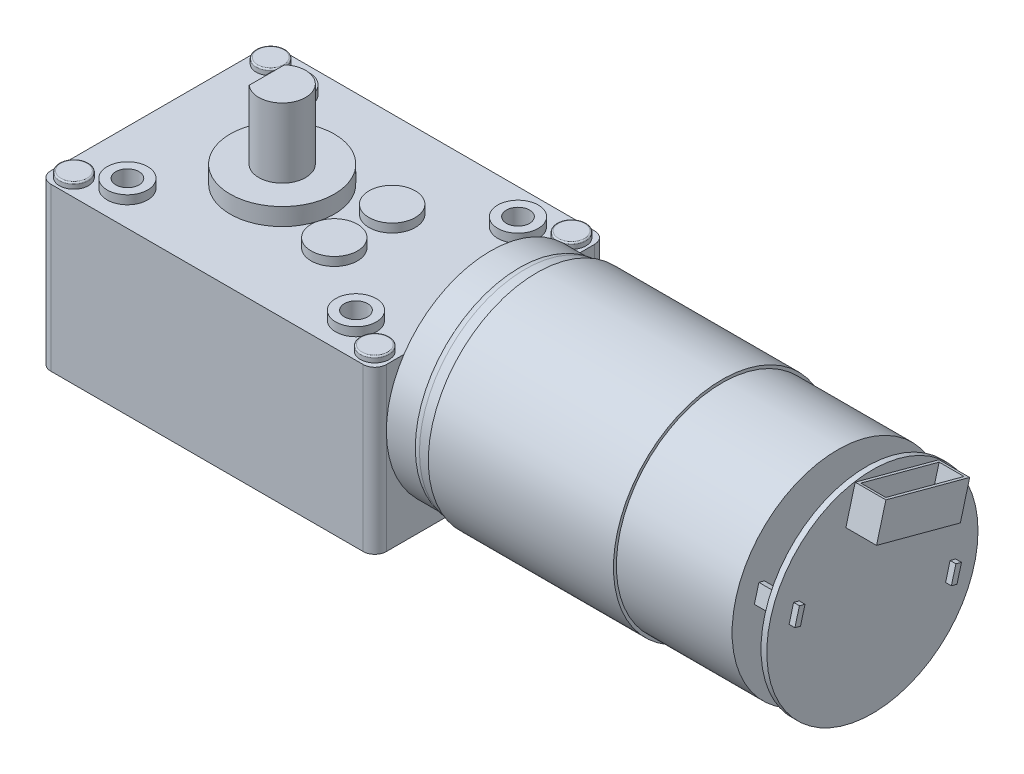
from build123d import *

# Parameters (mm, degrees)
CROQUIS1_W               = 58
CROQUIS1_H               = 40
SALIENTE_EXTRUIR1_DEPTH  = 28
CROQUIS2_R               = 2.5
SALIENTE_EXTRUIR2_DEPTH  = 1
SALIENTE_EXTRUIR3_DEPTH  = 1.5
CROQUIS4_R               = 9
CROQUIS4_R_2             = 4.05
SALIENTE_EXTRUIR4_DEPTH  = 3
CROQUIS5_R               = 4
SALIENTE_EXTRUIR5_DEPTH  = 1.5
REDONDEO1_R              = 0.25
REDONDEO2_R              = 0.1
REDONDEO3_R              = 2
SALIENTE_EXTRUIR6_START  = -31
CROQUIS7_R               = 3.5
CROQUIS7_R_2             = 2
SALIENTE_EXTRUIR6_DEPTH  = 31
SALIENTE_EXTRUIR7_START  = -33.5
CROQUIS8_R               = 9
CROQUIS8_R_2             = 4.05
SALIENTE_EXTRUIR7_DEPTH  = 33.5
SALIENTE_EXTRUIR8_START  = -30.5
CROQUIS9_R               = 4
SALIENTE_EXTRUIR8_DEPTH  = 30.5
CORTAR_EXTRUIR1_START    = -30.5
CROQUIS10_R              = 2
CORTAR_EXTRUIR1_DEPTH    = 30.5
SALIENTE_EXTRUIR9_DEPTH  = 15
CROQUIS12_R              = 18
SALIENTE_EXTRUIR10_DEPTH = 5
CROQUIS13_R              = 18.25
SALIENTE_EXTRUIR11_DEPTH = 3
REDONDEO4_R              = 2
CROQUIS14_R              = 18.75
SALIENTE_EXTRUIR12_DEPTH = 32
CROQUIS15_R              = 18.25
SALIENTE_EXTRUIR13_DEPTH = 20
SALIENTE_EXTRUIR14_DEPTH = 5
CROQUIS18_R              = 18.25
SALIENTE_EXTRUIR15_DEPTH = 1
SALIENTE_EXTRUIR16_DEPTH = 1
SALIENTE_EXTRUIR17_DEPTH = 5.3
CROQUIS21_W              = 4.3
CROQUIS21_H              = 14
CORTAR_EXTRUIR2_DEPTH    = 6


with BuildPart() as part:
    # Croquis1 → Saliente-Extruir1 (new body)
    with BuildSketch(Plane(origin=(0, 0, 0), x_dir=(1, 0, 0), z_dir=(0, 1, 0))):
        Rectangle(CROQUIS1_W, CROQUIS1_H)
    extrude(amount=SALIENTE_EXTRUIR1_DEPTH)

    # Croquis2 → Saliente-Extruir2 (add)
    with BuildSketch(Plane(origin=(0, 28, 0), x_dir=(1, 0, 0), z_dir=(0, 1, 0))):
        with Locations(Location((-26, 17, 0), (0, 0, 90))):
            Circle(CROQUIS2_R)
        with Locations(Location((26, 17, 0), (0, 0, 90))):
            Circle(CROQUIS2_R)
        with Locations(Location((26, -17, 0), (0, 0, 90))):
            Circle(CROQUIS2_R)
        with Locations(Location((-26, -17, 0), (0, 0, 90))):
            Circle(CROQUIS2_R)
    extrude(amount=SALIENTE_EXTRUIR2_DEPTH)

    # Croquis3 → Saliente-Extruir3 (add)
    with BuildSketch(Plane(origin=(0, 28, 0), x_dir=(1, 0, 0), z_dir=(0, 1, 0))):
        with BuildLine():
            ThreePointArc((-16.25, 14), (-22.224873734, 16.474873734), (-19.75, 10.5))
            Line((-19.75, 10.5), (-19.75, 12))
            ThreePointArc((-19.75, 12), (-21.164213562, 15.414213562), (-17.75, 14))
            Line((-17.75, 14), (-16.25, 14))
        make_face()
        with BuildLine():
            Line((-19.75, 12), (-19.75, 10.5))
            ThreePointArc((-19.75, 10.5), (-17.275126266, 11.525126266), (-16.25, 14))
            Line((-16.25, 14), (-17.75, 14))
            ThreePointArc((-17.75, 14), (-18.335786438, 12.585786438), (-19.75, 12))
        make_face()
        with BuildLine():
            ThreePointArc((-19.75, -12), (-18.335786438, -12.585786438), (-17.75, -14))
            Line((-17.75, -14), (-16.25, -14))
            ThreePointArc((-16.25, -14), (-17.275126266, -11.525126266), (-19.75, -10.5))
            Line((-19.75, -10.5), (-19.75, -12))
        make_face()
        with BuildLine():
            Line((-16.25, -14), (-17.75, -14))
            ThreePointArc((-17.75, -14), (-21.164213562, -15.414213562), (-19.75, -12))
            Line((-19.75, -12), (-19.75, -10.5))
            ThreePointArc((-19.75, -10.5), (-22.224873734, -16.474873734), (-16.25, -14))
        make_face()
        with BuildLine():
            ThreePointArc((19.75, -10.5), (17.275126266, -11.525126266), (16.25, -14))
            Line((16.25, -14), (17.75, -14))
            ThreePointArc((17.75, -14), (18.335786438, -12.585786438), (19.75, -12))
            Line((19.75, -12), (19.75, -10.5))
        make_face()
        with BuildLine():
            Line((17.75, -14), (16.25, -14))
            ThreePointArc((16.25, -14), (19.75, -17.5), (23.25, -14))
            ThreePointArc((23.25, -14), (22.224873734, -11.525126266), (19.75, -10.5))
            Line((19.75, -10.5), (19.75, -12))
            ThreePointArc((19.75, -12), (21.164213562, -12.585786438), (21.75, -14))
            ThreePointArc((21.75, -14), (19.75, -16), (17.75, -14))
        make_face()
        with BuildLine():
            ThreePointArc((16.25, 14), (17.275126266, 11.525126266), (19.75, 10.5))
            Line((19.75, 10.5), (19.75, 12))
            ThreePointArc((19.75, 12), (18.335786438, 12.585786438), (17.75, 14))
            Line((17.75, 14), (16.25, 14))
        make_face()
        with BuildLine():
            Line((19.75, 12), (19.75, 10.5))
            ThreePointArc((19.75, 10.5), (22.224873734, 11.525126266), (23.25, 14))
            ThreePointArc((23.25, 14), (19.75, 17.5), (16.25, 14))
            Line((16.25, 14), (17.75, 14))
            ThreePointArc((17.75, 14), (19.75, 16), (21.75, 14))
            ThreePointArc((21.75, 14), (21.164213562, 12.585786438), (19.75, 12))
        make_face()
    extrude(amount=SALIENTE_EXTRUIR3_DEPTH)

    # Croquis4 → Saliente-Extruir4 (add)
    with BuildSketch(Plane(origin=(0, 28, 0), x_dir=(1, 0, 0), z_dir=(0, 1, 0))):
        with Locations(Location((-7, 0, 0), (0, 0, 90))):
            Circle(CROQUIS4_R)
        with Locations(Location((-7, 0, 0), (0, 0, 270))):
            Circle(CROQUIS4_R_2, mode=Mode.SUBTRACT)
    extrude(amount=SALIENTE_EXTRUIR4_DEPTH)

    # Croquis5 → Saliente-Extruir5 (add)
    with BuildSketch(Plane(origin=(0, 28, 0), x_dir=(1, 0, 0), z_dir=(0, 1, 0))):
        with Locations(Location((7, 5, 0), (0, 0, 90))):
            Circle(CROQUIS5_R)
        with Locations(Location((7, -5, 0), (0, 0, 90))):
            Circle(CROQUIS5_R)
    extrude(amount=SALIENTE_EXTRUIR5_DEPTH)

    # Redondeo1
    redondeo1_edges = [part.edges().sort_by_distance(p)[0] for p in [
        (-26, 29, -14.5),
        (26, 29, -14.5),
        (26, 29, 19.5),
        (-26, 29, 19.5),
    ]]
    fillet(redondeo1_edges, radius=REDONDEO1_R)

    # Redondeo2
    redondeo2_edges = [part.edges().sort_by_distance(p)[0] for p in [
        (-19.75, 29.5, -17.5),
        (-23.25, 29.5, 14),
        (16.25, 29.5, 14),
        (23.25, 29.5, -14),
    ]]
    fillet(redondeo2_edges, radius=REDONDEO2_R)

    # Redondeo3
    redondeo3_edges = [part.edges().sort_by_distance(p)[0] for p in [
        (29, 14, 20),
        (-29, 14, 20),
        (-29, 14, -20),
        (29, 14, -20),
    ]]
    fillet(redondeo3_edges, radius=REDONDEO3_R)

    # Croquis7 → Saliente-Extruir6 (add)
    # profile 1 of 4: a face of its own
    with BuildSketch(Plane(origin=(0, 29.5, 0), x_dir=(1, 0, 0), z_dir=(0, 1, 0)).offset(SALIENTE_EXTRUIR6_START)):
        with Locations(Location((-19.75, 14, 0), (0, 0, 90))):
            Circle(CROQUIS7_R)
        with Locations(Location((-19.75, 14, 0), (0, 0, 270))):
            Circle(CROQUIS7_R_2, mode=Mode.SUBTRACT)
    # profile 2 of 4: a face of its own
    with BuildSketch(Plane(origin=(0, 29.5, 0), x_dir=(1, 0, 0), z_dir=(0, 1, 0)).offset(SALIENTE_EXTRUIR6_START)):
        with Locations(Location((-19.75, -14, 0), (0, 0, 90))):
            Circle(CROQUIS7_R)
        with Locations(Location((-19.75, -14, 0), (0, 0, 270))):
            Circle(CROQUIS7_R_2, mode=Mode.SUBTRACT)
    # profile 3 of 4: a face of its own
    with BuildSketch(Plane(origin=(0, 29.5, 0), x_dir=(1, 0, 0), z_dir=(0, 1, 0)).offset(SALIENTE_EXTRUIR6_START)):
        with Locations(Location((19.75, -14, 0), (0, 0, 90))):
            Circle(CROQUIS7_R)
        with Locations(Location((19.75, -14, 0), (0, 0, 270))):
            Circle(CROQUIS7_R_2, mode=Mode.SUBTRACT)
    # profile 4 of 4: a face of its own
    with BuildSketch(Plane(origin=(0, 29.5, 0), x_dir=(1, 0, 0), z_dir=(0, 1, 0)).offset(SALIENTE_EXTRUIR6_START)):
        with Locations(Location((19.75, 14, 0), (0, 0, 90))):
            Circle(CROQUIS7_R)
        with Locations(Location((19.75, 14, 0), (0, 0, 270))):
            Circle(CROQUIS7_R_2, mode=Mode.SUBTRACT)
    extrude(amount=SALIENTE_EXTRUIR6_DEPTH)

    # Croquis8 → Saliente-Extruir7 (add)
    with BuildSketch(Plane(origin=(0, 31, 0), x_dir=(1, 0, 0), z_dir=(0, 1, 0)).offset(SALIENTE_EXTRUIR7_START)):
        with Locations(Location((-7, 0, 0), (0, 0, 90))):
            Circle(CROQUIS8_R)
        with Locations(Location((-7, 0, 0), (0, 0, 270))):
            Circle(CROQUIS8_R_2, mode=Mode.SUBTRACT)
    extrude(amount=SALIENTE_EXTRUIR7_DEPTH)

    # Croquis9 → Saliente-Extruir8 (add)
    with BuildSketch(Plane(origin=(0, 29.5, 0), x_dir=(1, 0, 0), z_dir=(0, 1, 0)).offset(SALIENTE_EXTRUIR8_START)):
        with Locations(Location((7, 5, 0), (0, 0, 90))):
            Circle(CROQUIS9_R)
        with Locations(Location((7, -5, 0), (0, 0, 90))):
            Circle(CROQUIS9_R)
    extrude(amount=SALIENTE_EXTRUIR8_DEPTH)

    # Croquis10 → Cortar-Extruir1 (cut)
    with BuildSketch(Plane(origin=(0, 28, 0), x_dir=(1, 0, 0), z_dir=(0, 1, 0)).offset(CORTAR_EXTRUIR1_START)):
        with Locations(Location((-19.75, 14, 0), (0, 0, 270))):
            Circle(CROQUIS10_R)
        with Locations(Location((-19.75, -14, 0), (0, 0, 270))):
            Circle(CROQUIS10_R)
        with Locations(Location((19.75, -14, 0), (0, 0, 270))):
            Circle(CROQUIS10_R)
        with Locations(Location((19.75, 14, 0), (0, 0, 270))):
            Circle(CROQUIS10_R)
    extrude(amount=CORTAR_EXTRUIR1_DEPTH, mode=Mode.SUBTRACT)

    # Croquis11 → Saliente-Extruir9 (add)
    with BuildSketch(Plane(origin=(0, 28, 0), x_dir=(1, 0, 0), z_dir=(0, 1, 0))):
        with BuildLine():
            Line((-9.654829482, 3.058493162), (-9.654829482, -3.058493162))
            ThreePointArc((-9.654829482, -3.058493162), (-2.95, 0), (-9.654829482, 3.058493162))
        make_face()
    extrude(amount=SALIENTE_EXTRUIR9_DEPTH)

    # Croquis12 → Saliente-Extruir10 (add)
    with BuildSketch(Plane(origin=(29, 0, 0), x_dir=(0, 0, -1), z_dir=(1, 0, 0))):
        with Locations((0, 18)):
            Circle(CROQUIS12_R)
    extrude(amount=SALIENTE_EXTRUIR10_DEPTH)

    # Croquis13 → Saliente-Extruir11 (add)
    with BuildSketch(Plane(origin=(34, 0, 0), x_dir=(0, 0, -1), z_dir=(1, 0, 0))):
        with Locations((0, 18)):
            Circle(CROQUIS13_R)
    extrude(amount=SALIENTE_EXTRUIR11_DEPTH)

    # Redondeo4
    # the kernel refuses this fillet: 2 mm, written as the material it takes off along each edge
    with BuildSketch(Plane(origin=(34, 18, 0), x_dir=(0, 0, -1), z_dir=(0, -1, 0))) as redondeo4_piece_1:
        with BuildLine():
            CenterArc((16.25, 0.968245837), REDONDEO4_R, 331.044975628, 28.955024372)
            Line((18, 0), (18.035, -0.019364917))
            ThreePointArc((18.035, -0.019364917), (18.125, -0.04), (18.25, -0.04))
            Line((18.25, -0.04), (18.29, 0))
            Line((18.29, 0), (18.29, 0.968245837))
            Line((18.29, 0.968245837), (18.25, 0.968245837))
        make_face()
    revolve(axis=Axis((34, 18, 0), (1, 0, 0)), mode=Mode.SUBTRACT)

    # Croquis14 → Saliente-Extruir12 (add)
    with BuildSketch(Plane(origin=(37, 0, 0), x_dir=(0, 0, -1), z_dir=(1, 0, 0))):
        with Locations((0, 18)):
            Circle(CROQUIS14_R)
    extrude(amount=SALIENTE_EXTRUIR12_DEPTH)

    # Croquis15 → Saliente-Extruir13 (add)
    with BuildSketch(Plane(origin=(69, 0, 0), x_dir=(0, 0, -1), z_dir=(1, 0, 0))):
        with Locations(Location((0, 18, 0), (0, 0, 180))):
            Circle(CROQUIS15_R)
    extrude(amount=SALIENTE_EXTRUIR13_DEPTH)

    # Croquis16 → Saliente-Extruir14 (add)
    with BuildSketch(Plane(origin=(89, 0, 0), x_dir=(0, 0, -1), z_dir=(1, 0, 0))):
        Polygon((-14.394153049, 20.303987415), (-13.428227223, 20.045168369), (-12.651770087, 22.942945848), (-13.617695914, 23.201764893), align=None)
        Polygon((12.651770087, 13.057054152), (13.428227223, 15.954831631), (14.394153049, 15.696012585), (13.617695914, 12.798235107), align=None)
    extrude(amount=SALIENTE_EXTRUIR14_DEPTH)

    # Croquis18 → Saliente-Extruir15 (add)
    with BuildSketch(Plane(origin=(94, 0, 0), x_dir=(0, 0, -1), z_dir=(1, 0, 0))):
        with Locations(Location((0, 18, 0), (0, 0, 180))):
            Circle(CROQUIS18_R)
    extrude(amount=SALIENTE_EXTRUIR15_DEPTH)

    # Croquis19 → Saliente-Extruir16 (add)
    with BuildSketch(Plane(origin=(95, 0, 0), x_dir=(0, 0, -1), z_dir=(1, 0, 0))):
        Polygon((-14.394153049, 20.303987415), (-13.617695914, 23.201764893), (-12.651770087, 22.942945848), (-13.428227223, 20.045168369), align=None)
        Polygon((13.428227223, 15.954831631), (14.394153049, 15.696012585), (13.617695914, 12.798235107), (12.651770087, 13.057054152), align=None)
    extrude(amount=SALIENTE_EXTRUIR16_DEPTH)

    # Croquis20 → Saliente-Extruir17 (add)
    with BuildSketch(Plane(origin=(95, 0, 0), x_dir=(0, 0, -1), z_dir=(1, 0, 0))):
        Polygon((11.51440537, 31.99457107), (9.904913688, 25.98786634), (-4.583973706, 29.870152016), (-2.974482025, 35.876856747), align=None)
    extrude(amount=SALIENTE_EXTRUIR17_DEPTH)

    # Croquis21 → Cortar-Extruir2 (cut)
    with BuildSketch(Plane(origin=(0, 32.729942543, -8.769961673), x_dir=(1, 0, 0), z_dir=(0, -0.9659258262890691, 0.25881904510251813))):
        with Locations((97.65, 4.658742812)):
            Rectangle(CROQUIS21_W, CROQUIS21_H)
    extrude(amount=CORTAR_EXTRUIR2_DEPTH, mode=Mode.SUBTRACT)


solid = part.part
